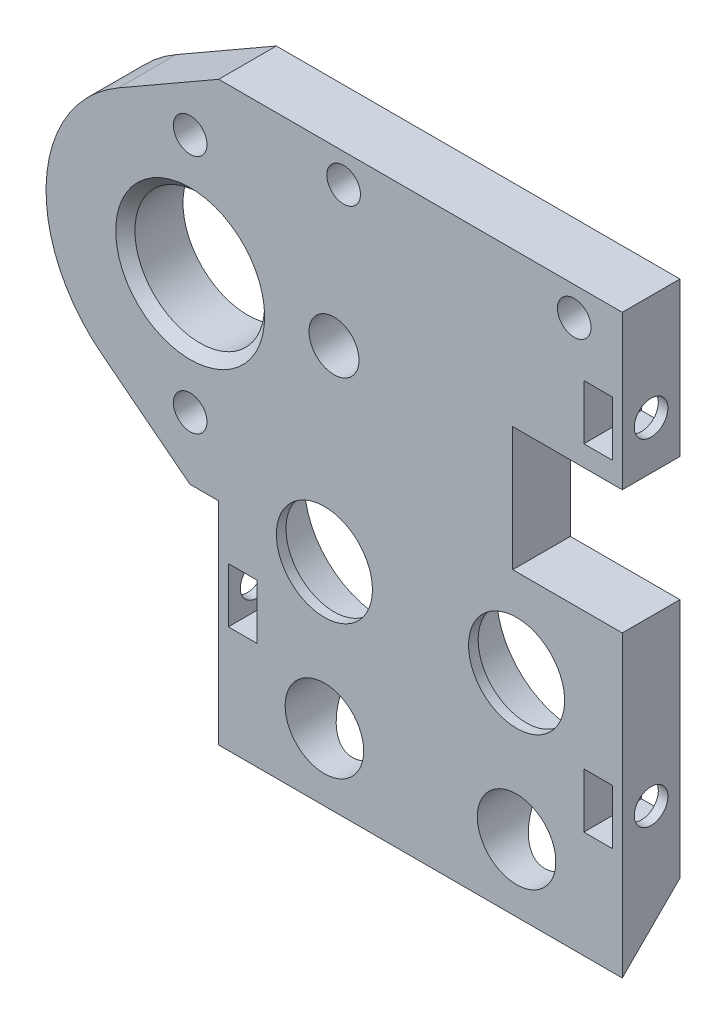
from build123d import *

# Parameters (mm, degrees)
SKETCH1_R           = 4.085
SKETCH1_R_2         = 5
SKETCH1_R_3         = 2.6
SKETCH1_R_4         = 2.5
SKETCH1_R_5         = 1.75
BOSS_EXTRUDE1_DEPTH = 6
CUT_EXTRUDE1_START  = -1
SKETCH2_R           = 8.085
CUT_EXTRUDE1_DEPTH  = 49.543181614
SKETCH5_R           = 6.75
CUT_EXTRUDE4_DEPTH  = 50.543181614
CHAMFER1_SIZE       = 6
SKETCH6_W           = 11.4
SKETCH6_H           = 12.9
CUT_EXTRUDE5_DEPTH  = 15
SKETCH7_R           = 1.75
SKETCH7_W           = 3
SKETCH7_H           = 5.7
CUT_EXTRUDE6_DEPTH  = 10
CUT_EXTRUDE7_START  = -42
SKETCH8_R           = 1.75
CUT_EXTRUDE7_DEPTH  = 4
CUT_EXTRUDE8_START  = -4
SKETCH8_2_R         = 1.75
CUT_EXTRUDE8_DEPTH  = 4
CHAMFER2_SIZE       = 1


with BuildPart() as part:
    # Sketch1 → Boss-Extrude1 (new body)
    with BuildSketch(Plane.XY):
        with BuildLine():
            Line((-21, -30), (21, -30))
            Line((21, -30), (21, 30))
            Line((21, 30), (-21, 30))
            Line((-21, 30), (-31.4362913, 24.008797289))
            ThreePointArc((-31.4362913, 24.008797289), (-38.93081829, 12.059456115), (-33.194824566, -0.826701779))
            Line((-33.194824566, -0.826701779), (-24, -8))
            Line((-24, -8), (-21, -8))
            Line((-21, -8), (-21, -30))
        make_face()
        with Locations((-10, -23)):
            Circle(SKETCH1_R, mode=Mode.SUBTRACT)
        with Locations((-10, -8)):
            Circle(SKETCH1_R_2, mode=Mode.SUBTRACT)
        with Locations(Location((10, -8, 0), (0, 0, 180))):
            Circle(SKETCH1_R_2, mode=Mode.SUBTRACT)
        with Locations(Location((10, -23, 0), (0, 0, 180))):
            Circle(SKETCH1_R, mode=Mode.SUBTRACT)
        with Locations((-9, 11.974984355)):
            Circle(SKETCH1_R_3, mode=Mode.SUBTRACT)
        with Locations((-23.968279978, 11)):
            Circle(SKETCH1_R_4, mode=Mode.SUBTRACT)
        with Locations((16, 27)):
            Circle(SKETCH1_R_5, mode=Mode.SUBTRACT)
        with Locations((-8, 27)):
            Circle(SKETCH1_R_5, mode=Mode.SUBTRACT)
    extrude(amount=BOSS_EXTRUDE1_DEPTH)

    # Sketch2 → Cut-Extrude1 (cut, through all)
    with BuildSketch(Plane.XY.offset(6).offset(CUT_EXTRUDE1_START)):
        with Locations((-10, -8)):
            Circle(SKETCH2_R)
        with Locations(Location((10, -8, 0), (0, 0, 180))):
            Circle(SKETCH2_R)
    extrude(amount=-CUT_EXTRUDE1_DEPTH, mode=Mode.SUBTRACT)

    # Sketch5 → Cut-Extrude4 (cut, through all)
    with BuildSketch(Plane.XY.offset(6)):
        with Locations((-23.968279978, 11)):
            Circle(SKETCH5_R)
    extrude(amount=-CUT_EXTRUDE4_DEPTH, mode=Mode.SUBTRACT)

    # Chamfer1
    # the kernel refuses this chamfer: 6 mm, written as the material it takes off along each edge
    with BuildSketch(Plane(origin=(-36.430097928, -30, 0), x_dir=(0, 0.9996219169112969, -0.027495876610586382), z_dir=(1, 0, 0))) as chamfer1_piece_1:
        Polygon((CHAMFER1_SIZE * 0.999621916911, CHAMFER1_SIZE * 0.0274958766106), (-CHAMFER1_SIZE * 0.0274958766106, CHAMFER1_SIZE * 0.999621916911), (0, 0), align=None)
    extrude(amount=72.860195856, mode=Mode.SUBTRACT)

    # Sketch6 → Cut-Extrude5 (cut)
    with BuildSketch(Plane(origin=(0, 0, 0), x_dir=(-1, 0, 0), z_dir=(0, 0, -1))):
        with Locations((-15.3, 7.55)):
            Rectangle(SKETCH6_W, SKETCH6_H)
    extrude(amount=-CUT_EXTRUDE5_DEPTH, mode=Mode.SUBTRACT)

    # Sketch7 → Cut-Extrude6 (cut)
    with BuildSketch(Plane(origin=(0, 0, 0), x_dir=(-1, 0, 0), z_dir=(0, 0, -1))):
        with Locations((23.968279978, 23.5)):
            Circle(SKETCH7_R)
        with Locations((23.968279978, -1.5)):
            Circle(SKETCH7_R)
        with Locations((-18.5, -16)):
            Rectangle(SKETCH7_W, SKETCH7_H)
        with Locations((18.5, -16)):
            Rectangle(SKETCH7_W, SKETCH7_H)
        with Locations((-18.5, 19)):
            Rectangle(SKETCH7_W, SKETCH7_H)
    extrude(amount=-CUT_EXTRUDE6_DEPTH, mode=Mode.SUBTRACT)

    # Sketch8 → Cut-Extrude7 (cut)
    with BuildSketch(Plane(origin=(21, 0, 0), x_dir=(0, 0, -1), z_dir=(1, 0, 0)).offset(CUT_EXTRUDE7_START)):
        with Locations(Location((-3, -16, 0), (0, 0, 270))):
            Circle(SKETCH8_R)
        with Locations(Location((-3, 19, 0), (0, 0, 90))):
            Circle(SKETCH8_R)
    extrude(amount=CUT_EXTRUDE7_DEPTH, mode=Mode.SUBTRACT)

    # Sketch8<2> → Cut-Extrude8 (cut)
    with BuildSketch(Plane(origin=(21, 0, 0), x_dir=(0, 0, -1), z_dir=(1, 0, 0)).offset(CUT_EXTRUDE8_START)):
        with Locations(Location((-3, -16, 0), (0, 0, 270))):
            Circle(SKETCH8_2_R)
        with Locations(Location((-3, 19, 0), (0, 0, 90))):
            Circle(SKETCH8_2_R)
    extrude(amount=CUT_EXTRUDE8_DEPTH, mode=Mode.SUBTRACT)

    # Chamfer2
    chamfer2_edges = [part.edges().sort_by_distance(p)[0] for p in [
        (-30.718279978, 11, 6),
    ]]
    chamfer(chamfer2_edges, length=CHAMFER2_SIZE)


solid = part.part
